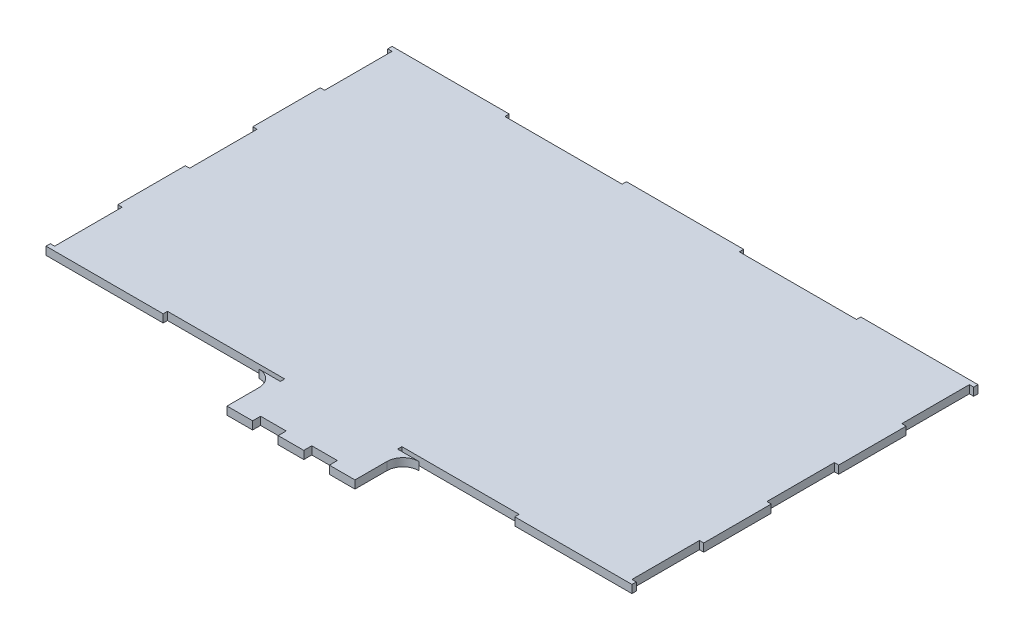
from build123d import *

# Parameters (mm, degrees)
BOSS_EXTRUDE1_DEPTH = 5


with BuildPart() as part:
    # Sketch1 → Boss-Extrude1 (new body)
    with BuildSketch(Plane(origin=(0, 0, 0), x_dir=(1, 0, 0), z_dir=(0, 1, 0))):
        with BuildLine():
            Line((-183.2, 108.2), (-109.92, 108.2))
            Line((-109.92, 108.2), (-109.92, 105.5))
            Line((-109.92, 105.5), (-36.64, 105.5))
            Line((-36.64, 105.5), (-36.64, 108.2))
            Line((-36.64, 108.2), (36.64, 108.2))
            Line((36.64, 108.2), (36.64, 105.5))
            Line((36.64, 105.5), (109.92, 105.5))
            Line((109.92, 105.5), (109.92, 108.2))
            Line((109.92, 108.2), (183.2, 108.2))
            Line((183.2, 108.2), (183.2, 105.5))
            Line((183.2, 105.5), (180.5, 105.5))
            Line((180.5, 105.5), (180.5, 63.3))
            Line((180.5, 63.3), (183.2, 63.3))
            Line((183.2, 63.3), (183.2, 21.1))
            Line((183.2, 21.1), (180.5, 21.1))
            Line((180.5, 21.1), (180.5, -21.1))
            Line((180.5, -21.1), (183.2, -21.1))
            Line((183.2, -21.1), (183.2, -63.3))
            Line((183.2, -63.3), (180.5, -63.3))
            Line((180.5, -63.3), (180.5, -105.5))
            Line((180.5, -105.5), (183.2, -105.5))
            Line((183.2, -105.5), (183.2, -108.2))
            Line((183.2, -108.2), (109.92, -108.2))
            Line((109.92, -108.2), (109.92, -105.5))
            Line((109.92, -105.5), (36.64, -105.5))
            Line((36.64, -105.5), (36.64, -108.2))
            Line((36.64, -108.2), (40, -108.2))
            Line((40, -108.2), (50, -108.2))
            ThreePointArc((50, -108.2), (42.928932188, -111.128932188), (40, -118.2))
            Line((40, -118.2), (40, -138.2))
            Line((40, -138.2), (24, -138.2))
            Line((24, -138.2), (24, -133.2))
            Line((24, -133.2), (8, -133.2))
            Line((8, -133.2), (8, -138.2))
            Line((8, -138.2), (-8, -138.2))
            Line((-8, -138.2), (-8, -133.2))
            Line((-8, -133.2), (-24, -133.2))
            Line((-24, -133.2), (-24, -138.2))
            Line((-24, -138.2), (-40, -138.2))
            Line((-40, -138.2), (-40, -118.2))
            ThreePointArc((-40, -118.2), (-42.928932188, -111.128932188), (-50, -108.2))
            Line((-50, -108.2), (-40, -108.2))
            Line((-40, -108.2), (-36.64, -108.2))
            Line((-36.64, -108.2), (-36.64, -105.5))
            Line((-36.64, -105.5), (-109.92, -105.5))
            Line((-109.92, -105.5), (-109.92, -108.2))
            Line((-109.92, -108.2), (-183.2, -108.2))
            Line((-183.2, -108.2), (-183.2, -105.5))
            Line((-183.2, -105.5), (-180.5, -105.5))
            Line((-180.5, -105.5), (-180.5, -63.3))
            Line((-180.5, -63.3), (-183.2, -63.3))
            Line((-183.2, -63.3), (-183.2, -21.1))
            Line((-183.2, -21.1), (-180.5, -21.1))
            Line((-180.5, -21.1), (-180.5, 21.1))
            Line((-180.5, 21.1), (-183.2, 21.1))
            Line((-183.2, 21.1), (-183.2, 63.3))
            Line((-183.2, 63.3), (-180.5, 63.3))
            Line((-180.5, 63.3), (-180.5, 105.5))
            Line((-180.5, 105.5), (-183.2, 105.5))
            Line((-183.2, 105.5), (-183.2, 108.2))
        make_face()
    extrude(amount=BOSS_EXTRUDE1_DEPTH)


solid = part.part
